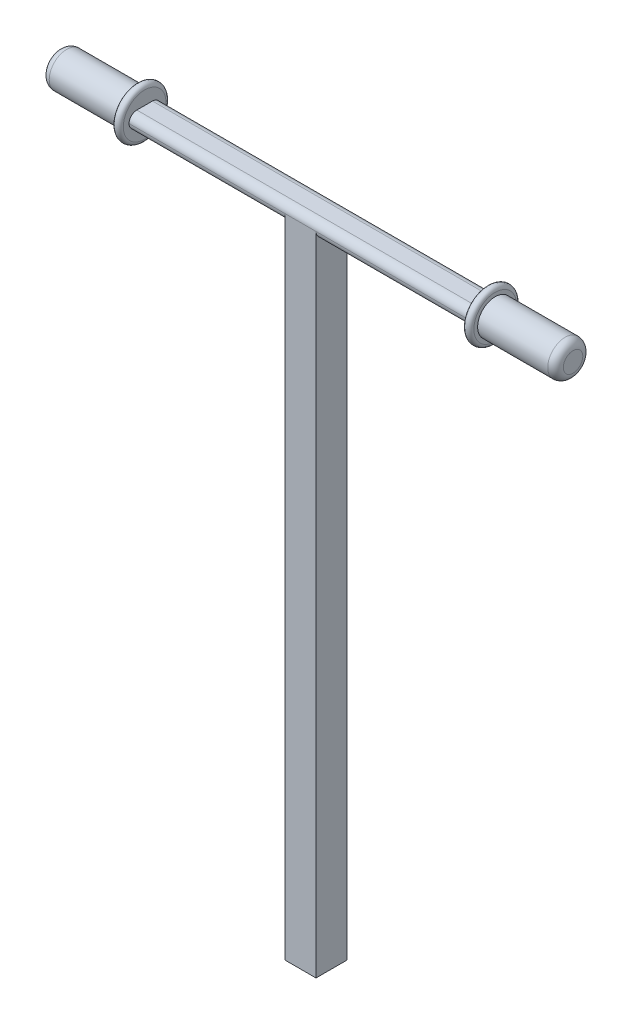
from build123d import *

# Parameters (mm, degrees)
BOSS_EXTRUDE1_DEPTH      = 290
BOSS_EXTRUDE1_DEPTH_BACK = 550
SKETCH1_W                = 40
SKETCH1_H                = 40
BOSS_EXTRUDE2_DEPTH      = 40
SKETCH3_R                = 32.360679775
BOSS_EXTRUDE3_DEPTH      = 10
SKETCH4_R                = 22.5
BOSS_EXTRUDE4_DEPTH      = 100
FILLET1_R                = 10
FILLET2_R                = 5
FILLET3_R                = 5
FILLET4_R                = 10


with BuildPart() as part:
    # Sketch1 → Boss-Extrude1 (new, two sides: drawn at the far end of the back side and taken through both)
    with BuildSketch(Plane(origin=(0, 0, 0), x_dir=(1, 0, 0), z_dir=(0, 1, 0)).offset(-BOSS_EXTRUDE1_DEPTH_BACK)):
        Rectangle(SKETCH1_W, SKETCH1_H)
    extrude(amount=BOSS_EXTRUDE1_DEPTH + BOSS_EXTRUDE1_DEPTH_BACK)

    # Sketch2 → Boss-Extrude2 (add)
    with BuildSketch(Plane.XY.offset(20)):
        Polygon((20, 290), (220, 290), (220, 270), (-220, 270), (-220, 290), (-20, 290), align=None)
    extrude(amount=-BOSS_EXTRUDE2_DEPTH)

    # Sketch3 → Boss-Extrude3 (add)
    with BuildSketch(Plane(origin=(220, 0, 0), x_dir=(0, 0, -1), z_dir=(1, 0, 0))):
        with Locations(Location((0, 280, 0), (0, 0, 90))):
            Circle(SKETCH3_R)
    boss_extrude3 = extrude(amount=BOSS_EXTRUDE3_DEPTH)

    # Sketch4 → Boss-Extrude4 (add)
    with BuildSketch(Plane(origin=(230, 0, 0), x_dir=(0, 0, -1), z_dir=(1, 0, 0))):
        with Locations(Location((0, 280, 0), (0, 0, 90))):
            Circle(SKETCH4_R)
    boss_extrude4 = extrude(amount=BOSS_EXTRUDE4_DEPTH)

    # Mirror1: Boss-Extrude3, Boss-Extrude4 across plane
    add(boss_extrude3.mirror(Plane(origin=(0, 0, 0), x_dir=(0, 0, 1), z_dir=(1, 0, 0))))
    add(boss_extrude4.mirror(Plane(origin=(0, 0, 0), x_dir=(0, 0, 1), z_dir=(1, 0, 0))))

    # Fillet1
    fillet1_edges = [part.edges().sort_by_distance(p)[0] for p in [
        (-120, 270, 20),
        (-120, 270, -20),
        (120, 270, 20),
        (120, 270, -20),
        (0, 290, -20),
        (0, 290, 20),
    ]]
    fillet(fillet1_edges, radius=FILLET1_R - 0.0001)  # a hair under: the kernel refuses the full size

    # Fillet2
    fillet2_edges = [part.edges().sort_by_distance(p)[0] for p in [
        (220, 247.639320225, 0),
        (230, 247.639320225, 0),
    ]]
    fillet(fillet2_edges, radius=FILLET2_R - 0.0001)  # a hair under: the kernel refuses the full size

    # Fillet3
    fillet3_edges = [part.edges().sort_by_distance(p)[0] for p in [
        (-230, 247.639320225, 0),
        (-220, 247.639320225, 0),
    ]]
    fillet(fillet3_edges, radius=FILLET3_R - 0.0001)  # a hair under: the kernel refuses the full size

    # Fillet4
    fillet4_edges = [part.edges().sort_by_distance(p)[0] for p in [
        (330, 257.5, 0),
        (-330, 257.5, 0),
    ]]
    fillet(fillet4_edges, radius=FILLET4_R)


solid = part.part
